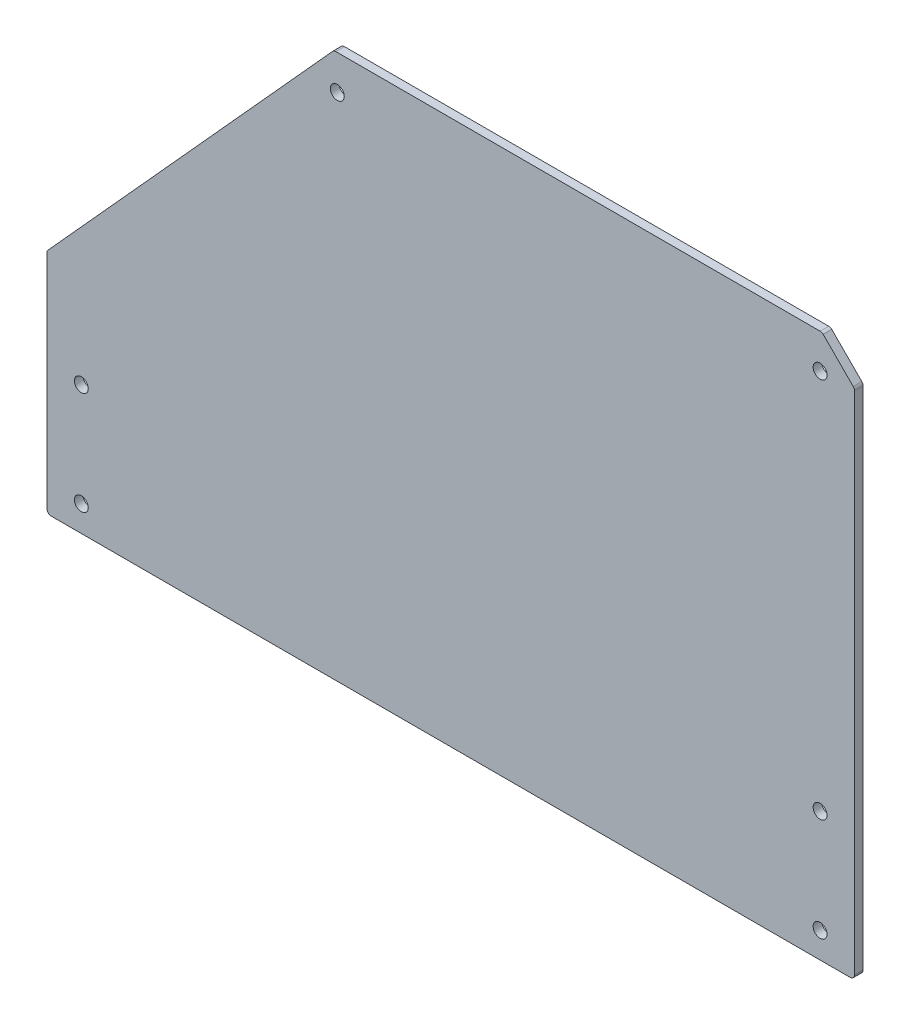
from build123d import *

# Parameters (mm, degrees)
SKETCH2_W           = 470
SKETCH2_H           = 317
BOSS_EXTRUDE1_DEPTH = 2.5
SKETCH3_R           = 4.05
CUT_EXTRUDE1_DEPTH  = 10
FILLET2_R           = 2.5
CUT_EXTRUDE14_DEPTH = 284.5
FILLET3_R           = 2.5


with BuildPart() as part:
    # Sketch2 → Boss-Extrude1 (new, symmetric)
    with BuildSketch(Plane.XY):
        Rectangle(SKETCH2_W, SKETCH2_H)
    extrude(amount=BOSS_EXTRUDE1_DEPTH, both=True)

    # Sketch3 → Cut-Extrude1 (cut)
    with BuildSketch(Plane.XY.offset(2.5)):
        with Locations((-215, -83.5)):
            Circle(SKETCH3_R)
        with Locations((-215, -143.5)):
            Circle(SKETCH3_R)
        with Locations((215, -83.5)):
            Circle(SKETCH3_R)
        with Locations((215, -143.5)):
            Circle(SKETCH3_R)
        with Locations((-66, 138.34)):
            Circle(SKETCH3_R)
        with Locations((215, 138.34)):
            Circle(SKETCH3_R)
    extrude(amount=-CUT_EXTRUDE1_DEPTH, mode=Mode.SUBTRACT)

    # Fillet2
    fillet2_edges = [part.edges().sort_by_distance(p)[0] for p in [
        (-235, -158.5, 0),
        (235, -158.5, 0),
        (235, 158.5, 0),
        (-235, 158.5, 0),
    ]]
    fillet(fillet2_edges, radius=FILLET2_R)

    # Sketch26 → Cut-Extrude14 (cut, through all)
    with BuildSketch(Plane.XY.offset(2.5)):
        Polygon((182.649467527, 192.063735909), (266.938205265, 107.461124705), (295.314616174, 135.732259875), (211.025878435, 220.334871078), align=None)
        Polygon((-37.197655418, 192.515548017), (-279.724979652, -75.442529533), (-279.724979652, 249.003513691), align=None)
    extrude(amount=-CUT_EXTRUDE14_DEPTH, mode=Mode.SUBTRACT)

    # Fillet3
    fillet3_edges = [part.edges().sort_by_distance(p)[0] for p in [
        (-235, -26.027810578, 0),
        (216.088682857, 158.5, 0),
        (235, 139.518261104, 0),
        (-67.984933482, 158.5, 0),
    ]]
    fillet(fillet3_edges, radius=FILLET3_R)


solid = part.part
